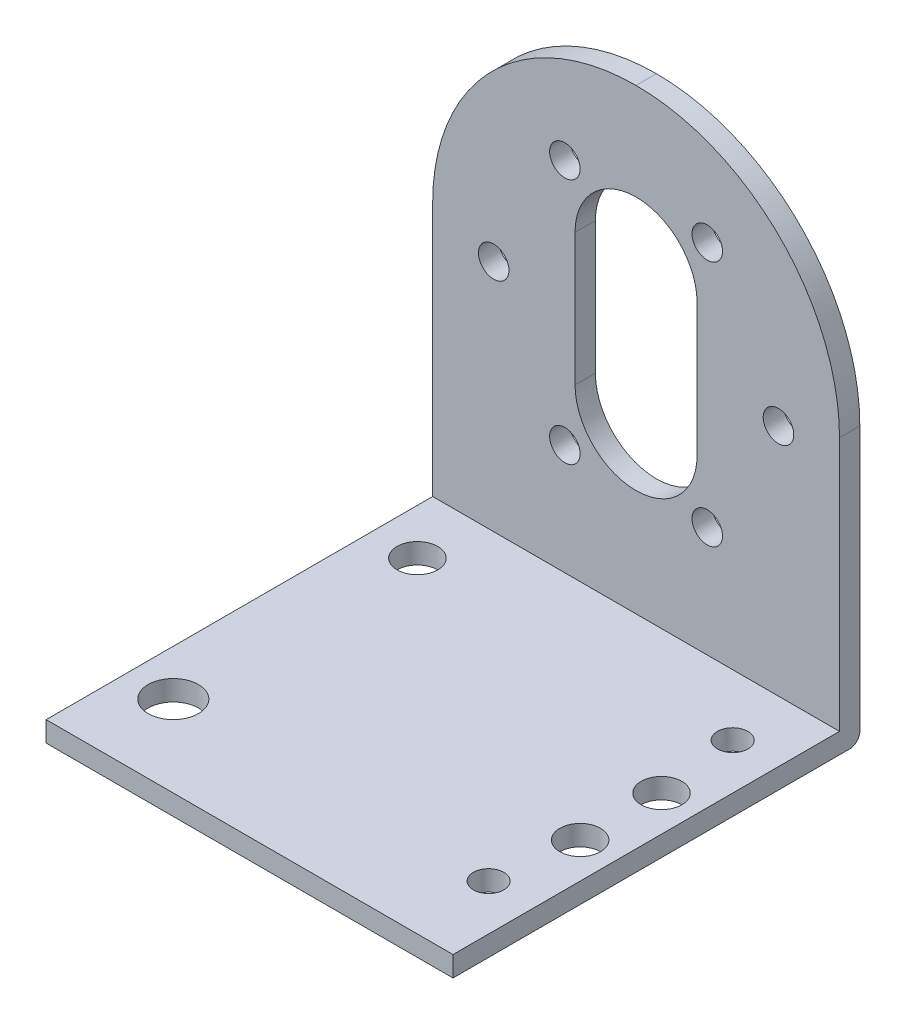
from build123d import *

# Parameters (mm, degrees)
SKETCH1_W           = 40
SKETCH1_H           = 38
SKETCH1_R           = 2.474873734
SKETCH1_R_2         = 1.5
SKETCH1_R_3         = 2
BOSS_EXTRUDE3_DEPTH = 2
SKETCH1_5_W         = 40
SKETCH1_5_H         = 2
BOSS_EXTRUDE4_DEPTH = 47
FILLET1_R           = 20
FILLET2_R           = 1
SKETCH2_R           = 1.5
CUT_EXTRUDE2_DEPTH  = 47


with BuildPart() as part:
    # Sketch1 → Boss-Extrude3 (new body)
    with BuildSketch(Plane(origin=(0, 0, 0), x_dir=(1, 0, 0), z_dir=(0, 1, 0))):
        with Locations((0, -1)):
            Rectangle(SKETCH1_W, SKETCH1_H)
        with Locations(Location((-15.5, -12, 0), (0, 0, 270))):
            Circle(SKETCH1_R, mode=Mode.SUBTRACT)
        with Locations(Location((15.5, -12, 0), (0, 0, 270))):
            Circle(SKETCH1_R_2, mode=Mode.SUBTRACT)
        with Locations(Location((16.5, -4, 0), (0, 0, 270))):
            Circle(SKETCH1_R_3, mode=Mode.SUBTRACT)
        with Locations(Location((-15.5, 12, 0), (0, 0, 270))):
            Circle(SKETCH1_R_3, mode=Mode.SUBTRACT)
        with Locations(Location((16.5, 4, 0), (0, 0, 270))):
            Circle(SKETCH1_R_3, mode=Mode.SUBTRACT)
        with Locations(Location((15.5, 12, 0), (0, 0, 270))):
            Circle(SKETCH1_R_2, mode=Mode.SUBTRACT)
    extrude(amount=BOSS_EXTRUDE3_DEPTH)

    # Sketch1<5> → Boss-Extrude4 (add)
    with BuildSketch(Plane(origin=(0, 0, 0), x_dir=(1, 0, 0), z_dir=(0, 1, 0))):
        with Locations((0, 19)):
            Rectangle(SKETCH1_5_W, SKETCH1_5_H)
    extrude(amount=BOSS_EXTRUDE4_DEPTH)

    # Fillet1
    fillet1_edges = [part.edges().sort_by_distance(p)[0] for p in [
        (20, 47, -19),
        (-20, 47, -19),
    ]]
    fillet(fillet1_edges, radius=FILLET1_R - 0.0001)  # a hair under: the kernel refuses the full size

    # Fillet2
    fillet2_edges = [part.edges().sort_by_distance(p)[0] for p in [
        (0, 0, -20),
    ]]
    fillet(fillet2_edges, radius=FILLET2_R)

    # Sketch2 → Cut-Extrude2 (cut)
    with BuildSketch(Plane.XY.offset(-18)):
        with Locations((-14, 25)):
            Circle(SKETCH2_R)
        with Locations((-7, 37.124355653)):
            Circle(SKETCH2_R)
        with Locations((7, 37.124355653)):
            Circle(SKETCH2_R)
        with Locations((14, 25)):
            Circle(SKETCH2_R)
        with Locations((7, 12.875644347)):
            Circle(SKETCH2_R)
        with Locations((-7, 12.875644347)):
            Circle(SKETCH2_R)
        with BuildLine():
            Line((6, 31.5), (6, 18.5))
            ThreePointArc((6, 18.5), (0, 12.5), (-6, 18.5))
            Line((-6, 18.5), (-6, 31.5))
            ThreePointArc((-6, 31.5), (0, 37.5), (6, 31.5))
        make_face()
    extrude(amount=-CUT_EXTRUDE2_DEPTH, mode=Mode.SUBTRACT)


solid = part.part
